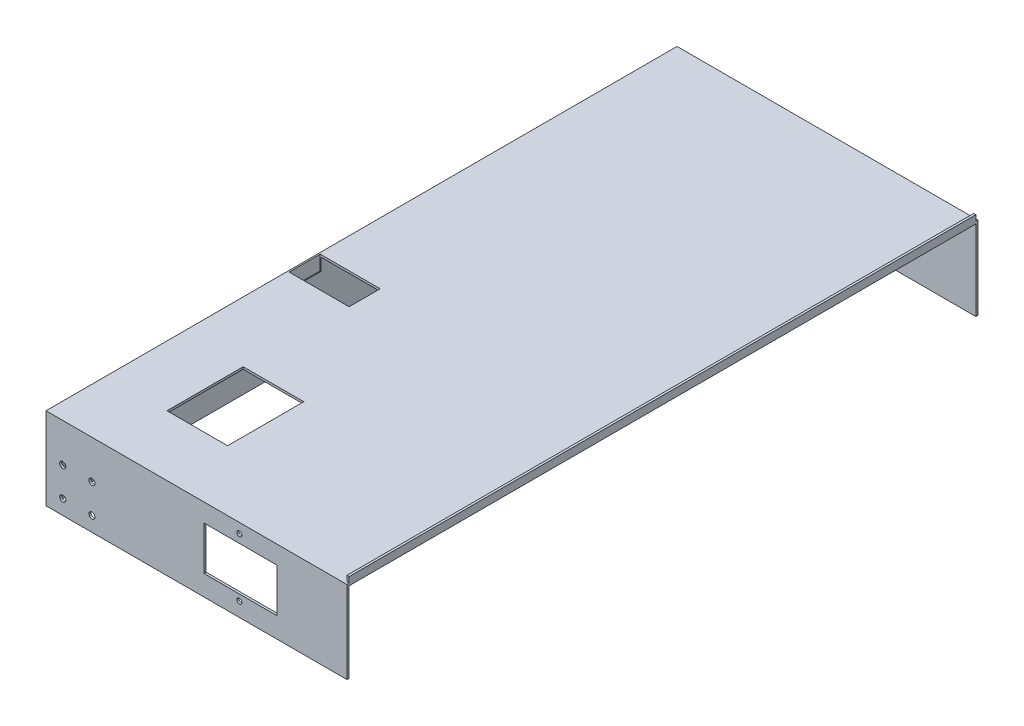
from build123d import *

# Parameters (mm, degrees)
SKETCH4_W            = 41.584358949
SKETCH4_H            = 52.301228267
BOSS_EXTRUDE4_DEPTH  = 1.5
SKETCH5_W            = 205
SKETCH5_H            = 56.5
BOSS_EXTRUDE5_DEPTH  = 1.5
SKETCH8_W            = 1.5
SKETCH8_H            = 430
BOSS_EXTRUDE14_DEPTH = 4
SKETCH7_W            = 205
SKETCH7_H            = 56.5
BOSS_EXTRUDE18_DEPTH = 1.5
SKETCH9_W            = 433
SKETCH9_H            = 56.5
BOSS_EXTRUDE19_DEPTH = 1.5
SKETCH15_R           = 2.1
CUT_EXTRUDE1_DEPTH   = 10
CUT_EXTRUDE2_START   = -10
SKETCH14_R           = 2.1
CUT_EXTRUDE2_DEPTH   = 10
CUT_EXTRUDE3_START   = -10
SKETCH12_R           = 2.1
CUT_EXTRUDE3_DEPTH   = 10
CUT_EXTRUDE4_START   = -10
SKETCH10_R           = 2.1
CUT_EXTRUDE4_DEPTH   = 10
CUT_EXTRUDE5_START   = -10
SKETCH11_R           = 2.1
CUT_EXTRUDE5_DEPTH   = 10
SKETCH17_W           = 41.213444594
SKETCH17_H           = 21.329304938
CUT_EXTRUDE6_DEPTH   = 10
SKETCH18_W           = 50
SKETCH18_H           = 30
CUT_EXTRUDE7_DEPTH   = 10
SKETCH19_R           = 1.75
CUT_EXTRUDE8_DEPTH   = 10


with BuildPart() as part:
    # Sketch4 → Boss-Extrude4 (new body)
    with BuildSketch(Plane(origin=(0, 0, 0), x_dir=(1, 0, 0), z_dir=(0, 1, 0))):
        Polygon((139.373653762, 430), (344.373653762, 430), (344.373653762, 0), (139.373653762, 0), (139.373653762, 65), (139.373653762, 230), align=None)
        with Locations((200.165833237, 66.150614133)):
            Rectangle(SKETCH4_W, SKETCH4_H, mode=Mode.SUBTRACT)
    extrude(amount=BOSS_EXTRUDE4_DEPTH)

    # Sketch5 → Boss-Extrude5 (add)
    with BuildSketch(Plane.XY):
        with Locations((241.873653762, -26.75)):
            Rectangle(SKETCH5_W, SKETCH5_H)
    extrude(amount=BOSS_EXTRUDE5_DEPTH)

    # Sketch8 → Boss-Extrude14 (add)
    with BuildSketch(Plane(origin=(0, 1.5, 0), x_dir=(1, 0, 0), z_dir=(0, 1, 0))):
        with Locations((343.623653762, 215)):
            Rectangle(SKETCH8_W, SKETCH8_H)
    extrude(amount=BOSS_EXTRUDE14_DEPTH)

    # Sketch7 → Boss-Extrude18 (add)
    with BuildSketch(Plane(origin=(0, 0, -430), x_dir=(-1, 0, 0), z_dir=(0, 0, -1))):
        with Locations((-241.873653762, -26.75)):
            Rectangle(SKETCH7_W, SKETCH7_H)
    extrude(amount=BOSS_EXTRUDE18_DEPTH)

    # Sketch9 → Boss-Extrude19 (add)
    with BuildSketch(Plane.ZY.offset(-139.373653762)):
        with Locations((-215, -26.75)):
            Rectangle(SKETCH9_W, SKETCH9_H)
    extrude(amount=BOSS_EXTRUDE19_DEPTH)

    # Sketch15 → Cut-Extrude1 (cut)
    with BuildSketch(Plane(origin=(0, 0, -431.5), x_dir=(-1, 0, 0), z_dir=(0, 0, -1))):
        with Locations((-169.373653762, -25)):
            Circle(SKETCH15_R)
        with Locations((-149.373653762, -25)):
            Circle(SKETCH15_R)
        with Locations((-169.373653762, -45)):
            Circle(SKETCH15_R)
        with Locations((-149.373653762, -45)):
            Circle(SKETCH15_R)
    extrude(amount=-CUT_EXTRUDE1_DEPTH, mode=Mode.SUBTRACT)

    # Sketch14 → Cut-Extrude2 (cut)
    with BuildSketch(Plane.XY.offset(1.5).offset(CUT_EXTRUDE2_START)):
        with Locations((169.373653762, -25)):
            Circle(SKETCH14_R)
    extrude(amount=CUT_EXTRUDE2_DEPTH, mode=Mode.SUBTRACT)

    # Sketch12 → Cut-Extrude3 (cut)
    with BuildSketch(Plane.XY.offset(1.5).offset(CUT_EXTRUDE3_START)):
        with Locations((149.373653762, -25)):
            Circle(SKETCH12_R)
    extrude(amount=CUT_EXTRUDE3_DEPTH, mode=Mode.SUBTRACT)

    # Sketch10 → Cut-Extrude4 (cut)
    with BuildSketch(Plane.XY.offset(1.5).offset(CUT_EXTRUDE4_START)):
        with Locations((169.373653762, -45)):
            Circle(SKETCH10_R)
    extrude(amount=CUT_EXTRUDE4_DEPTH, mode=Mode.SUBTRACT)

    # Sketch11 → Cut-Extrude5 (cut)
    with BuildSketch(Plane.XY.offset(1.5).offset(CUT_EXTRUDE5_START)):
        with Locations((149.373653762, -45)):
            Circle(SKETCH11_R)
    extrude(amount=CUT_EXTRUDE5_DEPTH, mode=Mode.SUBTRACT)

    # Sketch17 → Cut-Extrude6 (cut)
    with BuildSketch(Plane(origin=(0, 1.5, 0), x_dir=(1, 0, 0), z_dir=(0, 1, 0))):
        with Locations((159.4438263, 174.976392302)):
            Rectangle(SKETCH17_W, SKETCH17_H)
    extrude(amount=-CUT_EXTRUDE6_DEPTH, mode=Mode.SUBTRACT)

    # Sketch18 → Cut-Extrude7 (cut)
    with BuildSketch(Plane.XY.offset(1.5)):
        with Locations((271.304844591, -26)):
            Rectangle(SKETCH18_W, SKETCH18_H)
    extrude(amount=-CUT_EXTRUDE7_DEPTH, mode=Mode.SUBTRACT)

    # Sketch19 → Cut-Extrude8 (cut)
    with BuildSketch(Plane.XY.offset(1.5)):
        with Locations((270.543410902, -5.271453481)):
            Circle(SKETCH19_R)
        with Locations((270.543410902, -45.271453481)):
            Circle(SKETCH19_R)
    extrude(amount=-CUT_EXTRUDE8_DEPTH, mode=Mode.SUBTRACT)


solid = part.part
